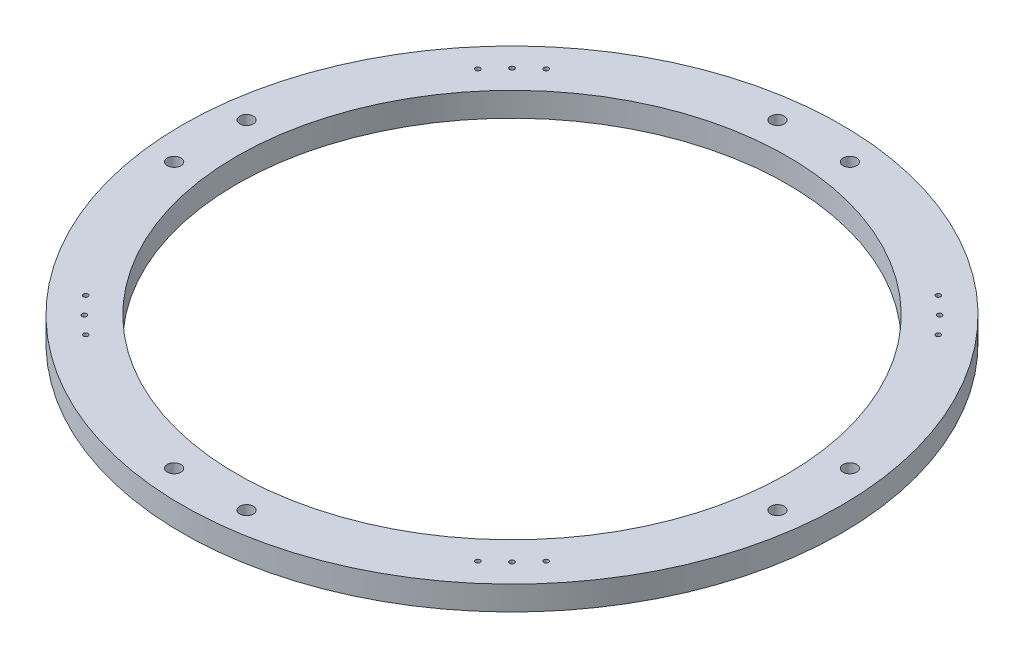
from build123d import *

# Parameters (mm, degrees)
SKETCH1_W                   = 28.575
SKETCH1_H                   = 12.7
TAP_DRILL_FOR_M3X0_5_TAP1_D = 2.5
SKETCH7_R                   = 3.571875
CUT_EXTRUDE1_DEPTH          = 246.499823847
CIRPATTERN1_COUNT           = 4


with BuildPart() as part:
    # Sketch1 → Revolve1 (revolve)
    with BuildSketch(Plane.XY):
        with Locations((159.074654908, 172.518849687)):
            Rectangle(SKETCH1_W, SKETCH1_H)
    revolve(axis=Axis((1e-09, -200000, 0), (0, 1, 0)))

    # Tap Drill for M3x0.5 Tap1 (through all)
    with Locations(Plane(origin=(0, 178.868849687, 0), x_dir=(1, 0, 0), z_dir=(0, 1, 0))):
        with Locations((-112.482767201, 112.482767201), (-103.143460893, 121.103973135), (-121.103973135, 103.143460893)):
            tap_drill_for_m3x0_5_tap1 = Hole(TAP_DRILL_FOR_M3X0_5_TAP1_D / 2)

    # Sketch7 → Cut-Extrude1 (cut, through all)
    with BuildSketch(Plane(origin=(0, 178.868849687, 0), x_dir=(1, 0, 0), z_dir=(0, 1, 0))):
        with Locations((158.674245572, -19.05)):
            Circle(SKETCH7_R)
        with Locations((158.674245572, 19.05)):
            Circle(SKETCH7_R)
    cut_extrude1 = extrude(amount=-CUT_EXTRUDE1_DEPTH, mode=Mode.SUBTRACT)

    # CirPattern1: Tap Drill for M3x0.5 Tap1, Cut-Extrude1 ×4 about axis
    cirpattern1_axis = Axis((1e-09, -200000, 0), (0, -1, 0))
    add([tap_drill_for_m3x0_5_tap1.rotate(cirpattern1_axis, i * 360 / CIRPATTERN1_COUNT) for i in range(1, CIRPATTERN1_COUNT)], mode=Mode.SUBTRACT)
    add([cut_extrude1.rotate(cirpattern1_axis, i * 360 / CIRPATTERN1_COUNT) for i in range(1, CIRPATTERN1_COUNT)], mode=Mode.SUBTRACT)


solid = part.part
